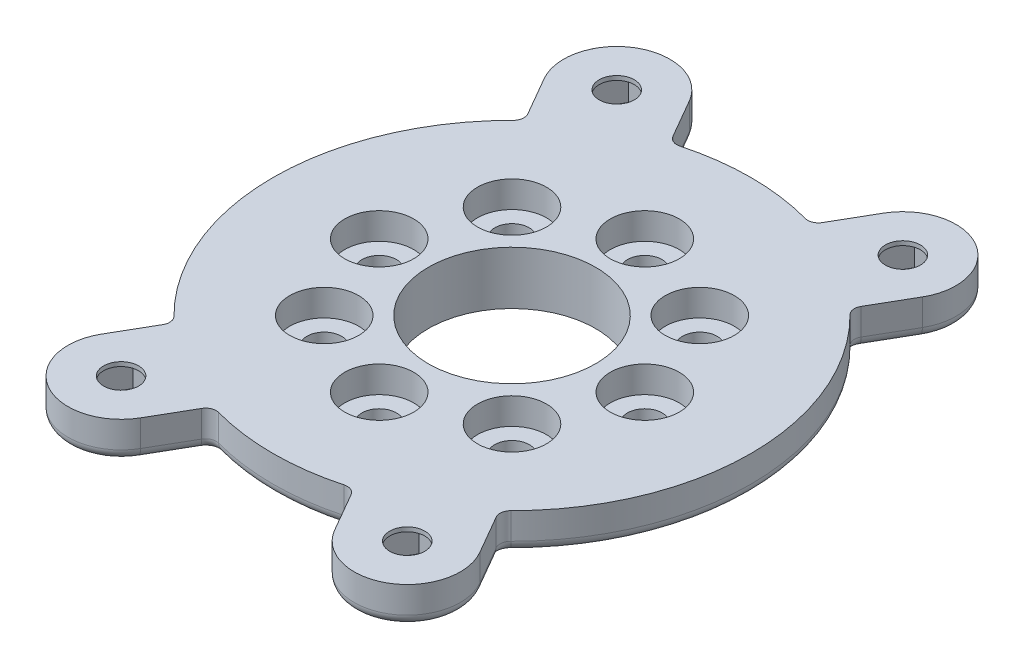
from build123d import *

# Parameters (mm, degrees)
SKETCH1_R                               = 45
BOSS_EXTRUDE1_DEPTH                     = 7
SKETCH10_R                              = 31.5
BOSS_EXTRUDE3_DEPTH                     = 3
CUT_EXTRUDE1_DEPTH                      = 65.02343321
CUT_EXTRUDE1_DEPTH_BACK                 = 65.02343321
SKETCH12_R                              = 15.75
CBORE_FOR_M6_HEX_HEAD_BOLT4_D           = 6.5
CBORE_FOR_M6_HEX_HEAD_BOLT4_CBORE_D     = 13
CBORE_FOR_M6_HEX_HEAD_BOLT4_CBORE_DEPTH = 5
CIRPATTERN11_COUNT                      = 8
BOSS_EXTRUDE4_DEPTH                     = 7
M6_CLEARANCE_HOLE1_D                    = 6.6
FILLET5_R                               = 2
CUT_EXTRUDE2_DEPTH                      = 2.7
MIRROR2_COPY_1_DEPTH                    = 2.7
FILLET7_R                               = 3


with BuildPart() as part:
    # Sketch1 → Boss-Extrude1 (new body)
    with BuildSketch(Plane(origin=(0, 0, 0), x_dir=(1, 0, 0), z_dir=(0, 1, 0))):
        with Locations(Location((0, 0, 0), (0, 0, 270))):
            Circle(SKETCH1_R)
    extrude(amount=BOSS_EXTRUDE1_DEPTH)

    # Sketch10 → Boss-Extrude3 (add)
    with BuildSketch(Plane(origin=(0, 0, 0), x_dir=(1, 0, 0), z_dir=(0, 1, 0))):
        with Locations(Location((0, 0, 0), (0, 0, 270))):
            Circle(SKETCH10_R)
    extrude(amount=-BOSS_EXTRUDE3_DEPTH)

    # Sketch12 → Cut-Extrude1 (cut, two sides: drawn at the far end of the back side and taken through both)
    with BuildSketch(Plane(origin=(0, 0, 0), x_dir=(1, 0, 0), z_dir=(0, 1, 0)).offset(-CUT_EXTRUDE1_DEPTH_BACK)):
        with Locations(Location((0, 0, 0), (0, 0, 270))):
            Circle(SKETCH12_R)
    extrude(amount=CUT_EXTRUDE1_DEPTH + CUT_EXTRUDE1_DEPTH_BACK, mode=Mode.SUBTRACT)

    # CBORE for M6 Hex Head Bolt4 (through all)
    with Locations(Plane(origin=(0, 7, 0), x_dir=(1, 0, 0), z_dir=(0, 1, 0))):
        with Locations((0, 25)):
            cbore_for_m6_hex_head_bolt4 = CounterBoreHole(CBORE_FOR_M6_HEX_HEAD_BOLT4_D / 2, CBORE_FOR_M6_HEX_HEAD_BOLT4_CBORE_D / 2, CBORE_FOR_M6_HEX_HEAD_BOLT4_CBORE_DEPTH)

    # CirPattern11: CBORE for M6 Hex Head Bolt4 ×8 about axis
    cirpattern11_axis = Axis((0, 0, 0), (0, 1, 0))
    for i in range(1, CIRPATTERN11_COUNT):
        add(cbore_for_m6_hex_head_bolt4.rotate(cirpattern11_axis, i * 360 / CIRPATTERN11_COUNT), mode=Mode.SUBTRACT)

    # Sketch19 → Boss-Extrude4 (add)
    with BuildSketch(Plane(origin=(0, 7, 0), x_dir=(1, 0, 0), z_dir=(0, 1, 0))):
        with BuildLine():
            Line((-30.597665006, 32.996710384), (-35.597665006, 41.656964422))
            ThreePointArc((-35.597665006, 41.656964422), (-31.937410968, 55.31721846), (-18.277156931, 51.656964422))
            Line((-18.277156931, 51.656964422), (-13.277156931, 42.996710384))
            Line((-13.277156931, 42.996710384), (-30.597665006, 32.996710384))
        make_face()
        with BuildLine():
            Line((13.277156931, 42.996710384), (18.277156931, 51.656964422))
            ThreePointArc((18.277156931, 51.656964422), (31.937410968, 55.31721846), (35.597665006, 41.656964422))
            Line((35.597665006, 41.656964422), (30.597665006, 32.996710384))
            Line((30.597665006, 32.996710384), (13.277156931, 42.996710384))
        make_face()
        with BuildLine():
            Line((30.597665006, -32.996710384), (35.597665006, -41.656964422))
            ThreePointArc((35.597665006, -41.656964422), (31.937410968, -55.31721846), (18.277156931, -51.656964422))
            Line((18.277156931, -51.656964422), (13.277156931, -42.996710384))
            Line((13.277156931, -42.996710384), (30.597665006, -32.996710384))
        make_face()
        with BuildLine():
            Line((-13.277156931, -42.996710384), (-18.277156931, -51.656964422))
            ThreePointArc((-18.277156931, -51.656964422), (-31.937410968, -55.31721846), (-35.597665006, -41.656964422))
            Line((-35.597665006, -41.656964422), (-30.597665006, -32.996710384))
            Line((-30.597665006, -32.996710384), (-13.277156931, -42.996710384))
        make_face()
    extrude(amount=-BOSS_EXTRUDE4_DEPTH)

    # M6 Clearance Hole1 (through all)
    with Locations(Plane(origin=(0, 7, 0), x_dir=(1, 0, 0), z_dir=(0, 1, 0))):
        with Locations((-26.937410968, 46.656964422), (26.937410968, 46.656964422), (-26.937410968, -46.656964422), (26.937410968, -46.656964422)):
            Hole(M6_CLEARANCE_HOLE1_D / 2)

    # Fillet5
    fillet5_edges = [part.edges().sort_by_distance(p)[0] for p in [
        (45, 0, 0),
        (31.937410968, 0, 55.31721846),
        (15.777156931, 0, 47.326837403),
        (13.277156931, 3.5, 42.996710384),
        (33.097665006, 0, 37.326837403),
        (30.597665006, 3.5, 32.996710384),
        (0, 0, 45),
        (-31.937410968, 0, 55.31721846),
        (-33.097665006, 0, 37.326837403),
        (-30.597665006, 3.5, 32.996710384),
        (-15.777156931, 0, 47.326837403),
        (-13.277156931, 3.5, 42.996710384),
        (-45, 0, 0),
        (-13.277156931, 3.5, -42.996710384),
        (-33.097665006, 0, -37.326837403),
        (-30.597665006, 3.5, -32.996710384),
        (-31.937410968, 0, -55.31721846),
        (-15.777156931, 0, -47.326837403),
        (0, 0, -45),
        (31.937410968, 0, -55.31721846),
        (33.097665006, 0, -37.326837403),
        (30.597665006, 3.5, -32.996710384),
        (15.777156931, 0, -47.326837403),
        (13.277156931, 3.5, -42.996710384),
    ]]
    fillet(fillet5_edges, radius=FILLET5_R)

    # Sketch22 → Cut-Extrude2 (cut, symmetric)
    with BuildSketch(Plane(origin=(0, 3.5, 0), x_dir=(1, 0, 0), z_dir=(0, 1, 0))):
        Polygon((-23.906322055, -41.406964422), (-29.968499882, -41.406964422), (-32.999588795, -46.656964422), (-29.968499882, -51.906964422), (-23.906322055, -51.906964422), (-20.875233142, -46.656964422), align=None)
    cut_extrude2 = extrude(amount=CUT_EXTRUDE2_DEPTH, both=True, mode=Mode.SUBTRACT)

    # Mirror1: Cut-Extrude2 across plane
    add(cut_extrude2.mirror(Plane(origin=(0, 0, 0), x_dir=(0, 0, 1), z_dir=(1, 0, 0))), mode=Mode.SUBTRACT)

    # Mirror2: Cut-Extrude2 across plane
    add(cut_extrude2.mirror(Plane.XY), mode=Mode.SUBTRACT)

    # Mirror2 copy 1 sketch → Mirror2 copy 1 (cut, symmetric)
    with BuildSketch(Plane(origin=(0, 3.5, 0), x_dir=(-1, 0, 0), z_dir=(0, 1, 0))):
        Polygon((-23.906322055, -41.406964422), (-29.968499882, -41.406964422), (-32.999588795, -46.656964422), (-29.968499882, -51.906964422), (-23.906322055, -51.906964422), (-20.875233142, -46.656964422), align=None)
    extrude(amount=MIRROR2_COPY_1_DEPTH, both=True, mode=Mode.SUBTRACT)

    # Fillet7
    fillet7_edges = [part.edges().sort_by_distance(p)[0] for p in [
        (0, 0, -31.5),
    ]]
    fillet(fillet7_edges, radius=FILLET7_R - 0.0001)  # a hair under: the kernel refuses the full size


solid = part.part
